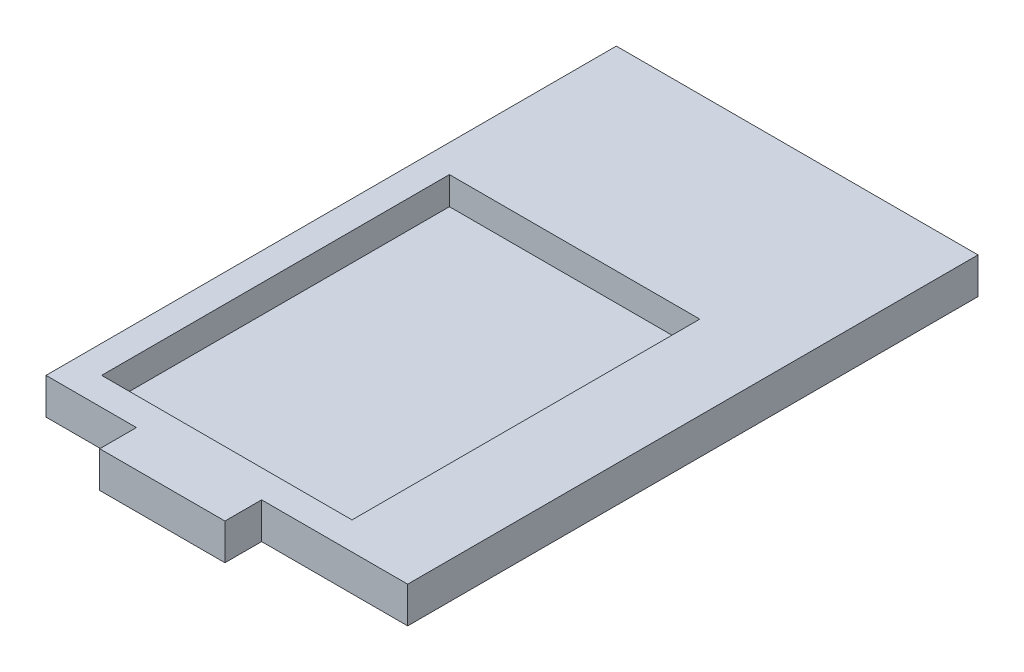
from build123d import *

# Parameters (mm, degrees)
BOSS_EXTRUDE1_DEPTH = 3
BOSS_EXTRUDE2_DEPTH = 10


with BuildPart() as part:
    # Sketch1 → Boss-Extrude1 (new body)
    with BuildSketch(Plane(origin=(0, 0, 0), x_dir=(1, 0, 0), z_dir=(0, 1, 0))):
        Polygon((-10, 195), (-10, -10), (22.5, -10), (22.5, -23.183655632), (67.5, -23.183655632), (67.5, -10), (120, -10), (120, 195), align=None)
    extrude(amount=-BOSS_EXTRUDE1_DEPTH)

    # Sketch1<3> → Boss-Extrude2 (add)
    with BuildSketch(Plane(origin=(0, 0, 0), x_dir=(1, 0, 0), z_dir=(0, 1, 0))):
        Polygon((-10, -10), (22.5, -10), (22.5, -23.183655632), (67.5, -23.183655632), (67.5, -10), (120, -10), (120, 195), (-10, 195), align=None)
        Polygon((90, 0), (45, 0), (0, 0), (0, 125), (90, 125), align=None, mode=Mode.SUBTRACT)
    extrude(amount=BOSS_EXTRUDE2_DEPTH)


solid = part.part
